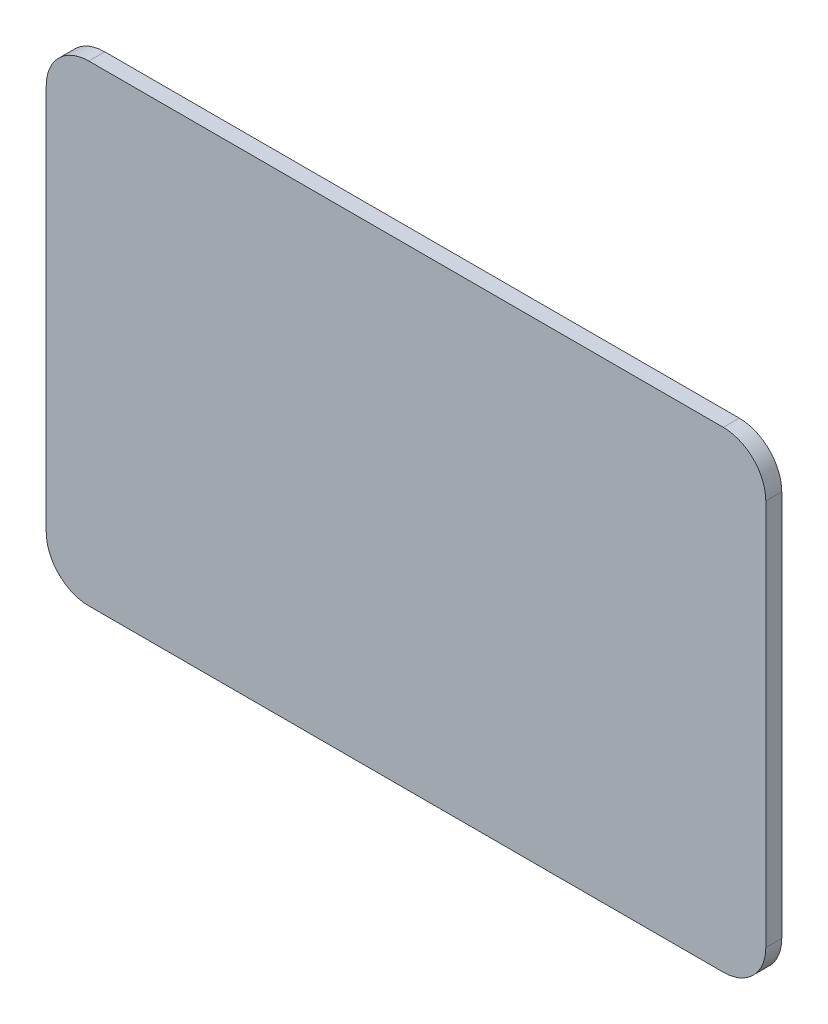
from build123d import *

# Parameters (mm, degrees)
BOSS_EXTRUDE1_DEPTH = 6


with BuildPart() as part:
    # Sketch1 → Boss-Extrude1 (new body)
    with BuildSketch(Plane.XY):
        with BuildLine():
            Line((270.5, 171.4), (270.5, 26))
            ThreePointArc((270.5, 26), (265.813708499, 14.686291501), (254.5, 10))
            Line((254.5, 10), (16, 10))
            ThreePointArc((16, 10), (4.686291501, 14.686291501), (0, 26))
            Line((0, 26), (0, 171.4))
            ThreePointArc((0, 171.4), (4.686291501, 182.713708499), (16, 187.4))
            Line((16, 187.4), (254.5, 187.4))
            ThreePointArc((254.5, 187.4), (265.813708499, 182.713708499), (270.5, 171.4))
        make_face()
    extrude(amount=BOSS_EXTRUDE1_DEPTH)


solid = part.part
